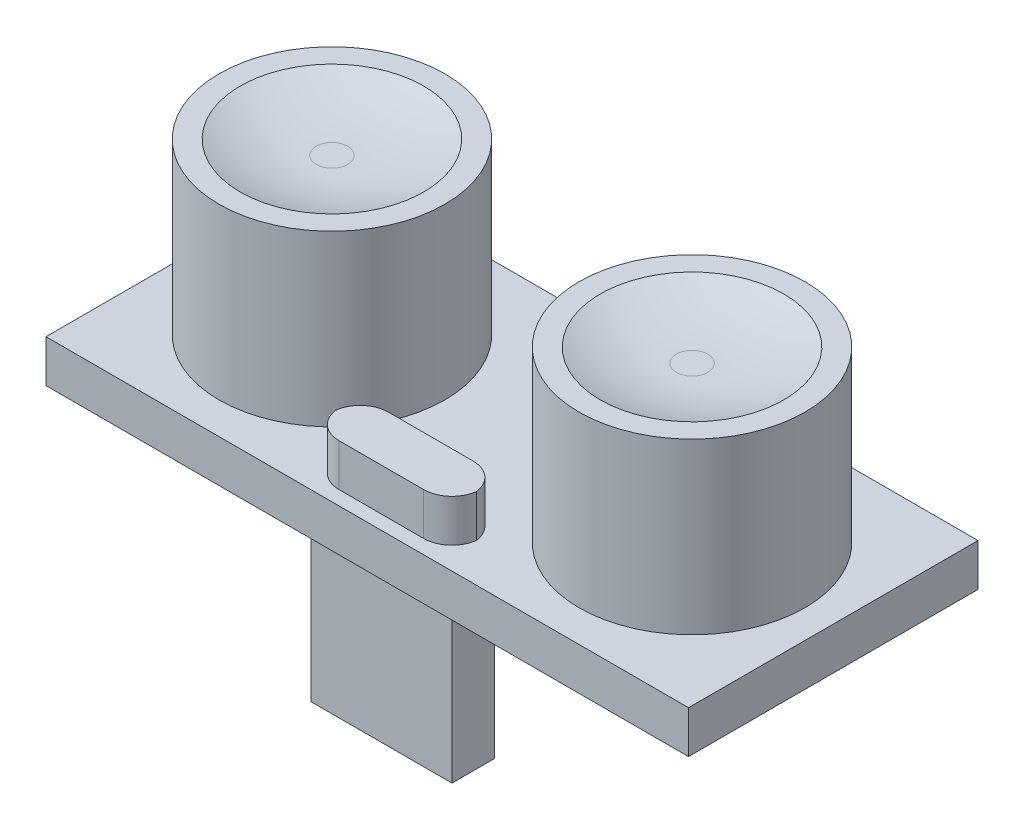
from build123d import *

# Parameters (mm, degrees)
SKETCH1_W           = 45.5
SKETCH1_H           = 20.5
BOSS_EXTRUDE1_DEPTH = 3
SKETCH2_R           = 8
BOSS_EXTRUDE2_DEPTH = 12
SKETCH3_W           = 10
SKETCH3_H           = 3
BOSS_EXTRUDE3_DEPTH = 11
SKETCH4_R           = 6.5
CUT_EXTRUDE1_DEPTH  = 1
FILLET1_R           = 15
SKETCH5_W           = 10
SKETCH5_H           = 3.5
BOSS_EXTRUDE4_DEPTH = 3
FILLET2_R           = 2


with BuildPart() as part:
    # Sketch1 → Boss-Extrude1 (new body)
    with BuildSketch(Plane(origin=(0, 0, 0), x_dir=(1, 0, 0), z_dir=(0, 1, 0))):
        with Locations((22.75, 10.25)):
            Rectangle(SKETCH1_W, SKETCH1_H)
    extrude(amount=BOSS_EXTRUDE1_DEPTH)

    # Sketch2 → Boss-Extrude2 (add)
    with BuildSketch(Plane(origin=(0, 3, 0), x_dir=(1, 0, 0), z_dir=(0, 1, 0))):
        with Locations(Location((10, 10.25, 0), (0, 0, 90))):
            Circle(SKETCH2_R)
        with Locations(Location((35.5, 10.25, 0), (0, 0, 90))):
            Circle(SKETCH2_R)
    extrude(amount=BOSS_EXTRUDE2_DEPTH)

    # Sketch3 → Boss-Extrude3 (add)
    with BuildSketch(Plane.XZ):
        with Locations((22.75, -2.5)):
            Rectangle(SKETCH3_W, SKETCH3_H)
    extrude(amount=BOSS_EXTRUDE3_DEPTH)

    # Sketch4 → Cut-Extrude1 (cut)
    with BuildSketch(Plane(origin=(0, 15, 0), x_dir=(1, 0, 0), z_dir=(0, 1, 0))):
        with Locations(Location((10, 10.25, 0), (0, 0, 270))):
            Circle(SKETCH4_R)
        with Locations(Location((35.5, 10.25, 0), (0, 0, 270))):
            Circle(SKETCH4_R)
    extrude(amount=-CUT_EXTRUDE1_DEPTH, mode=Mode.SUBTRACT)

    # Fillet1
    # the kernel refuses this fillet: 15 mm, written as the material it adds along each edge
    with BuildSketch(Plane(origin=(10, 14, -10.25), x_dir=(0, 0, 1), z_dir=(-1, 0, 0))) as fillet1_piece_1:
        with BuildLine():
            CenterArc((1.114835193, 15), FILLET1_R, 270, 21.039469781)
            Line((1.114835193, 0), (1.114835193, -0.3))
            Line((1.114835193, -0.3), (6.5, -0.3))
            Line((6.5, -0.3), (6.8, 0))
            ThreePointArc((6.8, 0), (6.8, 0.5), (6.607703296, 0.72))
            Line((6.607703296, 0.72), (6.5, 1))
        make_face()
    revolve(axis=Axis((10, 14, -10.25), (0, 1, 0)))
    with BuildSketch(Plane(origin=(35.5, 14, -10.25), x_dir=(0, 0, 1), z_dir=(-1, 0, 0))) as fillet1_piece_2:
        with BuildLine():
            CenterArc((1.114835193, 15), FILLET1_R, 270, 21.039469781)
            Line((1.114835193, 0), (1.114835193, -0.3))
            Line((1.114835193, -0.3), (6.5, -0.3))
            Line((6.5, -0.3), (6.8, 0))
            ThreePointArc((6.8, 0), (6.8, 0.5), (6.607703296, 0.72))
            Line((6.607703296, 0.72), (6.5, 1))
        make_face()
    revolve(axis=Axis((35.5, 14, -10.25), (0, 1, 0)))

    # Sketch5 → Boss-Extrude4 (add)
    with BuildSketch(Plane(origin=(0, 3, 0), x_dir=(1, 0, 0), z_dir=(0, 1, 0))):
        with Locations((22.75, 2.75)):
            Rectangle(SKETCH5_W, SKETCH5_H)
    extrude(amount=BOSS_EXTRUDE4_DEPTH)

    # Fillet2
    # the kernel refuses this fillet: 2 mm, written as the material it takes off along each edge
    with BuildSketch(Plane(origin=(17.75, 3, -1), x_dir=(0, 0, -1), z_dir=(0, 1, 0)), Plane(origin=(27.75, 3, -1), x_dir=(-1, 0, 0), z_dir=(0, 1, 0)), Plane(origin=(27.75, 3, -4.5), x_dir=(0, 0, 1), z_dir=(0, 1, 0))) as fillet2_piece_1:
        with BuildLine():
            CenterArc((FILLET2_R, -FILLET2_R), FILLET2_R, 90, 90)
            Line((0, -FILLET2_R), (0, 0))
            Line((0, 0), (FILLET2_R, 0))
        make_face()
    extrude(amount=8, mode=Mode.SUBTRACT)
    with BuildSketch(Plane(origin=(17.75, 3, -4.5), x_dir=(0, 0, 1), z_dir=(0, 1, 0))) as fillet2_piece_2:
        with BuildLine():
            CenterArc((FILLET2_R, FILLET2_R), FILLET2_R, 180, 90)
            Line((0, FILLET2_R), (0, 0))
            Line((0, 0), (FILLET2_R, 0))
        make_face()
    extrude(amount=8, mode=Mode.SUBTRACT)


solid = part.part
